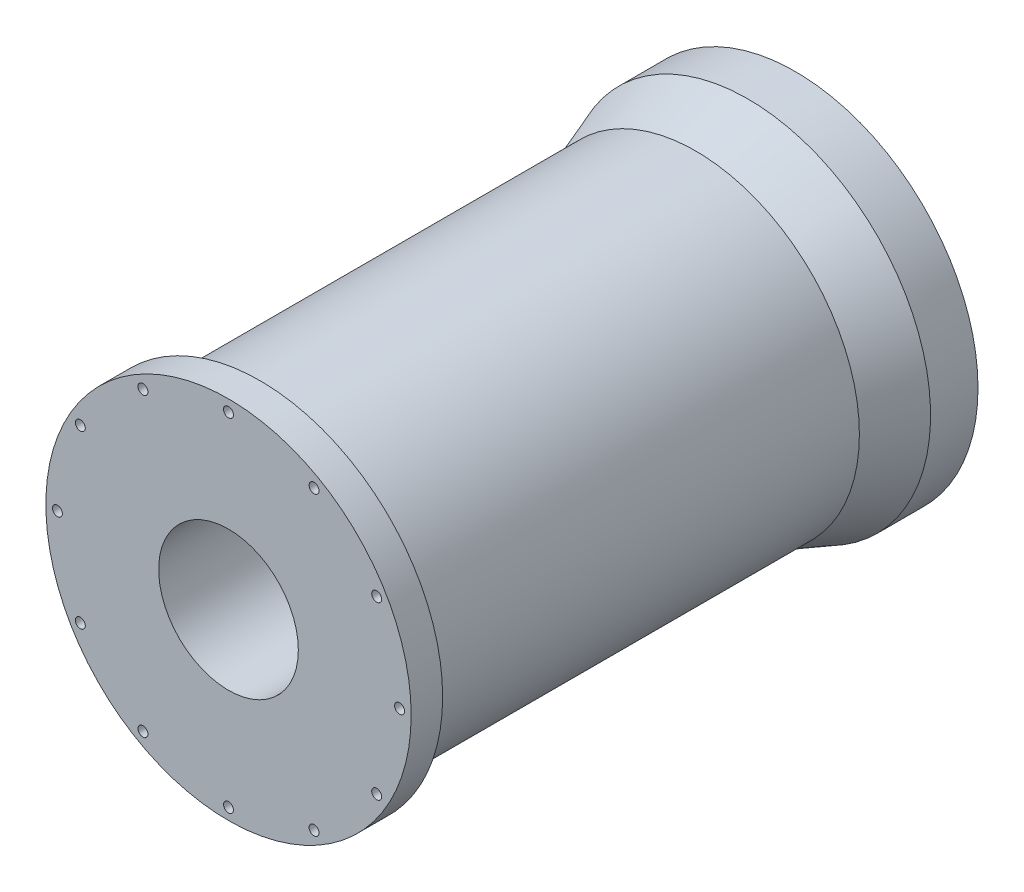
from build123d import *

# Parameters (mm, degrees)
SKETCH2_R           = 73.66
BOSS_EXTRUDE1_DEPTH = 12.7
SKETCH3_R           = 66
BOSS_EXTRUDE2_DEPTH = 203.2
SKETCH4_R           = 73.66
BOSS_EXTRUDE3_DEPTH = 12.7
SKETCH6_R           = 2
CUT_EXTRUDE1_DEPTH  = 12.7
CHAMFER1_SIZE       = 27.474774195
CHAMFER1_SIZE_2     = 10
SKETCH8_R           = 28.1625529
CUT_EXTRUDE2_DEPTH  = 150


with BuildPart() as part:
    # Sketch2 → Boss-Extrude1 (new body)
    with BuildSketch(Plane.XY):
        Circle(SKETCH2_R)
    extrude(amount=BOSS_EXTRUDE1_DEPTH)

    # Sketch3 → Boss-Extrude2 (add)
    with BuildSketch(Plane.XY.offset(12.7)):
        Circle(SKETCH3_R)
    extrude(amount=BOSS_EXTRUDE2_DEPTH)

    # Sketch4 → Boss-Extrude3 (add)
    with BuildSketch(Plane.XY.offset(215.9)):
        Circle(SKETCH4_R)
    extrude(amount=BOSS_EXTRUDE3_DEPTH)

    # Sketch6 → Cut-Extrude1 (cut)
    with BuildSketch(Plane.XY.offset(228.6)):
        with Locations((0, 69)):
            Circle(SKETCH6_R)
        with Locations((34.5, 59.755752861)):
            Circle(SKETCH6_R)
        with Locations((59.755752861, 34.5)):
            Circle(SKETCH6_R)
        with Locations((69, 0)):
            Circle(SKETCH6_R)
        with Locations((59.755752861, -34.5)):
            Circle(SKETCH6_R)
        with Locations((34.5, -59.755752861)):
            Circle(SKETCH6_R)
        with Locations((0, -69)):
            Circle(SKETCH6_R)
        with Locations((-34.5, -59.755752861)):
            Circle(SKETCH6_R)
        with Locations((-59.755752861, -34.5)):
            Circle(SKETCH6_R)
        with Locations((-69, 0)):
            Circle(SKETCH6_R)
        with Locations((-59.755752861, 34.5)):
            Circle(SKETCH6_R)
        with Locations((-34.5, 59.755752861)):
            Circle(SKETCH6_R)
    extrude(amount=-CUT_EXTRUDE1_DEPTH, mode=Mode.SUBTRACT)

    # Chamfer1
    # the kernel refuses this chamfer: 27.474774195, 10 mm, written as the material it adds along each edge
    with BuildSketch(Plane(origin=(0, 0, 12.7), x_dir=(1, 0, 0), z_dir=(0, -1, 0))) as chamfer1_piece_1_section:
        Polygon((66, CHAMFER1_SIZE), (66 + CHAMFER1_SIZE_2, 0), (66, 0), align=None)
    chamfer1_piece_1 = revolve(axis=Axis((0, 0, 12.7), (0, 0, 1)), mode=Mode.PRIVATE)
    chamfer1_piece_1 = chamfer1_piece_1 & Plane(origin=(0, 0, 30.030529596), x_dir=(1, 0, 0), z_dir=(0, 0, -1)) * Cylinder(73.66, 304, mode=Mode.PRIVATE)
    add(chamfer1_piece_1)

    # Sketch8 → Cut-Extrude2 (cut)
    with BuildSketch(Plane.XY.offset(228.6)):
        Circle(SKETCH8_R)
    extrude(amount=-CUT_EXTRUDE2_DEPTH, mode=Mode.SUBTRACT)


solid = part.part
